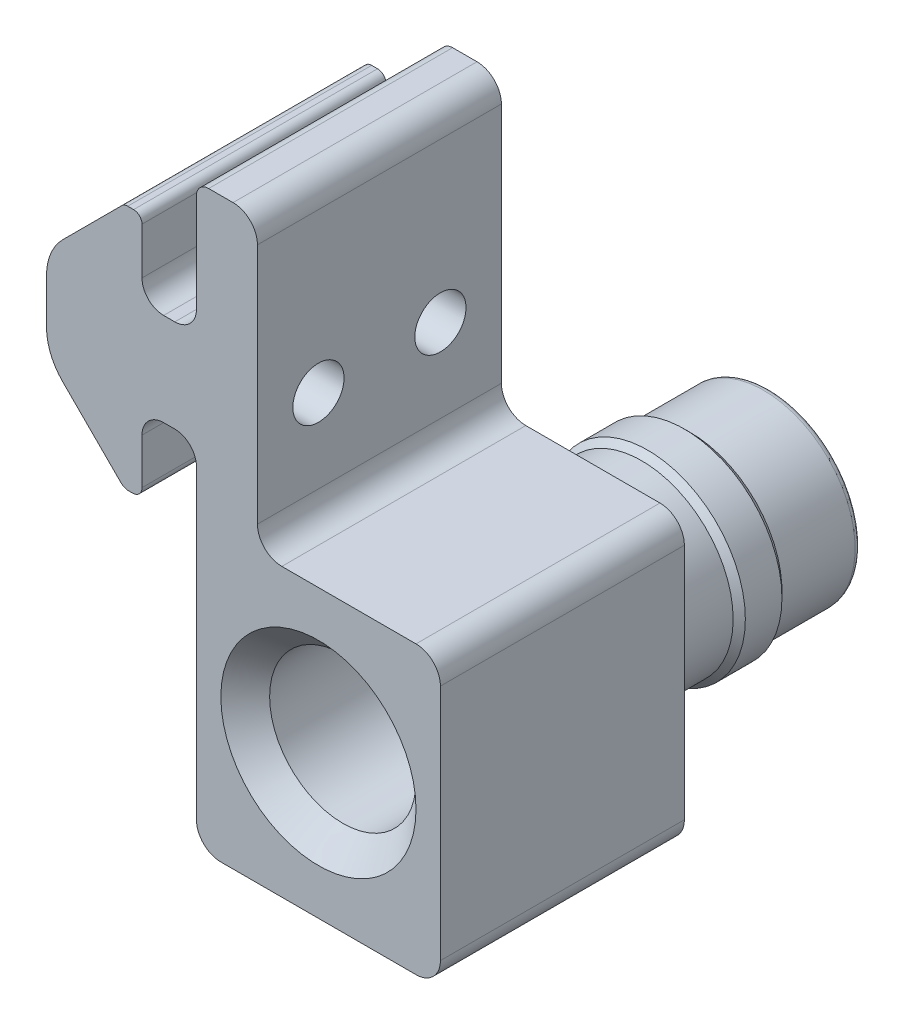
from build123d import *

# Parameters (mm, degrees)
BOSS_EXTRUDE1_DEPTH = 20
SKETCH3_R           = 2.1
CUT_EXTRUDE1_DEPTH  = 43.842719799
SKETCH4_R           = 7.5
BOSS_EXTRUDE2_DEPTH = 7
SKETCH5_R           = 8
BOSS_EXTRUDE3_DEPTH = 3
SKETCH6_R           = 7.5
BOSS_EXTRUDE4_DEPTH = 7
SKETCH7_R           = 6
CUT_EXTRUDE2_DEPTH  = 77.839573439
FILLET1_R           = 1
CHAMFER1_SIZE       = 0.5
CHAMFER2_SIZE       = 2
FILLET2_R           = 0.5


with BuildPart() as part:
    # Sketch1 → Boss-Extrude1 (new body)
    with BuildSketch(Plane.XY):
        with BuildLine():
            Line((38.3, 10.745623604), (38.3, 9.881410941))
            Line((38.3, 9.881410941), (38.3, 5.394343623))
            Line((38.3, 5.394343623), (38.3, -11.605656377))
            ThreePointArc((38.3, -11.605656377), (38.885786438, -13.01986994), (40.3, -13.605656377))
            Line((40.3, -13.605656377), (51.3, -13.605656377))
            Line((51.3, -13.605656377), (56.3, -13.605656377))
            ThreePointArc((56.3, -13.605656377), (57.714213562, -13.01986994), (58.3, -11.605656377))
            Line((58.3, -11.605656377), (58.3, 7.881410941))
            ThreePointArc((58.3, 7.881410941), (57.714213562, 9.295624503), (56.3, 9.881410941))
            Line((56.3, 9.881410941), (45.3, 9.881410941))
            ThreePointArc((45.3, 9.881410941), (43.885786438, 10.467197379), (43.3, 11.881410941))
            Line((43.3, 11.881410941), (43.3, 31.710978016))
            ThreePointArc((43.3, 31.710978016), (42.714213562, 33.125191579), (41.3, 33.710978016))
            Line((41.3, 33.710978016), (39.3, 33.710978016))
            ThreePointArc((39.3, 33.710978016), (38.592893219, 33.418084798), (38.3, 32.710978016))
            Line((38.3, 32.710978016), (38.3, 28.215588568))
            Line((38.3, 28.215588568), (38.3, 27.353495632))
            Line((38.3, 27.353495632), (38.3, 24.630195866))
            ThreePointArc((38.3, 24.630195866), (37.780173169, 23.37522288), (36.525200183, 22.855396049))
            Line((36.525200183, 22.855396049), (35.6108, 22.855396049))
            ThreePointArc((35.6108, 22.855396049), (34.355826885, 23.375222934), (33.836, 24.630196049))
            Line((33.836, 24.630196049), (33.836, 28.448))
            ThreePointArc((33.836, 28.448), (33.634196572, 28.935196572), (33.147, 29.137))
            Line((33.147, 29.137), (32.664287242, 29.137))
            ThreePointArc((32.664287242, 29.137), (32.400617966, 29.084552836), (32.177090071, 28.935195973))
            Line((32.177090071, 28.935195973), (27.33900161, 24.097095612))
            ThreePointArc((27.33900161, 24.097095612), (26.352731832, 22.621035632), (26.0064, 20.879905136))
            Line((26.0064, 20.879905136), (26.0064, 17.220094864))
            ThreePointArc((26.0064, 17.220094864), (26.352731832, 15.478964368), (27.33900161, 14.002904388))
            Line((27.33900161, 14.002904388), (32.090366071, 9.25152824))
            ThreePointArc((32.090366071, 9.25152824), (32.409953896, 9.037986056), (32.786933649, 8.963))
            Line((32.786933649, 8.963), (33.060275787, 8.963))
            ThreePointArc((33.060275787, 8.963), (33.608795638, 9.190204362), (33.836, 9.738724213))
            Line((33.836, 9.738724213), (33.836, 13.469803585))
            ThreePointArc((33.836, 13.469803585), (34.355826992, 14.724776959), (35.610800366, 15.244603951))
            Line((35.610800366, 15.244603951), (36.5252, 15.244603951))
            ThreePointArc((36.5252, 15.244603951), (37.780173115, 14.724777066), (38.3, 13.469803951))
            Line((38.3, 13.469803951), (38.3, 10.745623604))
        make_face()
    extrude(amount=-BOSS_EXTRUDE1_DEPTH)

    # Sketch3 → Cut-Extrude1 (cut, through all)
    with BuildSketch(Plane(origin=(43.3, 0, 0), x_dir=(0, 0, -1), z_dir=(1, 0, 0))):
        with Locations((5, 18.710978016)):
            Circle(SKETCH3_R)
        with Locations(Location((15, 18.710978016, 0), (0, 0, 314.769611651))):
            Circle(SKETCH3_R)
    extrude(amount=-CUT_EXTRUDE1_DEPTH, mode=Mode.SUBTRACT)

    # Sketch4 → Boss-Extrude2 (add)
    with BuildSketch(Plane(origin=(0, 0, -20), x_dir=(-1, 0, 0), z_dir=(0, 0, -1))):
        with Locations(Location((-48.3, -1.862122718, 0), (0, 0, 180))):
            Circle(SKETCH4_R)
    extrude(amount=BOSS_EXTRUDE2_DEPTH)

    # Sketch5 → Boss-Extrude3 (add)
    with BuildSketch(Plane(origin=(0, 0, -27), x_dir=(-1, 0, 0), z_dir=(0, 0, -1))):
        with Locations((-48.3, -1.862122718)):
            Circle(SKETCH5_R)
    extrude(amount=BOSS_EXTRUDE3_DEPTH)

    # Sketch6 → Boss-Extrude4 (add)
    with BuildSketch(Plane(origin=(0, 0, -30), x_dir=(-1, 0, 0), z_dir=(0, 0, -1))):
        with Locations(Location((-48.3, -1.862122718, 0), (0, 0, 180))):
            Circle(SKETCH6_R)
    extrude(amount=BOSS_EXTRUDE4_DEPTH)

    # Sketch7 → Cut-Extrude2 (cut, through all)
    with BuildSketch(Plane(origin=(0, 0, -37), x_dir=(-1, 0, 0), z_dir=(0, 0, -1))):
        with Locations((-48.3, -1.862122718)):
            Circle(SKETCH7_R)
    extrude(amount=-CUT_EXTRUDE2_DEPTH, mode=Mode.SUBTRACT)

    # Fillet1
    fillet1_edges = [part.edges().sort_by_distance(p)[0] for p in [
        (40.8, -1.862122718, -20),
    ]]
    fillet(fillet1_edges, radius=FILLET1_R)

    # Chamfer1
    chamfer1_edges = [part.edges().sort_by_distance(p)[0] for p in [
        (40.8, -1.862122718, -27),
        (40.8, -1.862122718, -30),
    ]]
    chamfer(chamfer1_edges, length=CHAMFER1_SIZE - 0.0001)  # a hair under: the kernel refuses the full size

    # Chamfer2
    chamfer2_edges = [part.edges().sort_by_distance(p)[0] for p in [
        (54.3, -1.862122718, 0),
    ]]
    chamfer(chamfer2_edges, length=CHAMFER2_SIZE)

    # Fillet2
    fillet2_edges = [part.edges().sort_by_distance(p)[0] for p in [
        (40.8, -1.862122718, -37),
        (54.3, -1.862122718, -37),
    ]]
    fillet(fillet2_edges, radius=FILLET2_R)


solid = part.part
